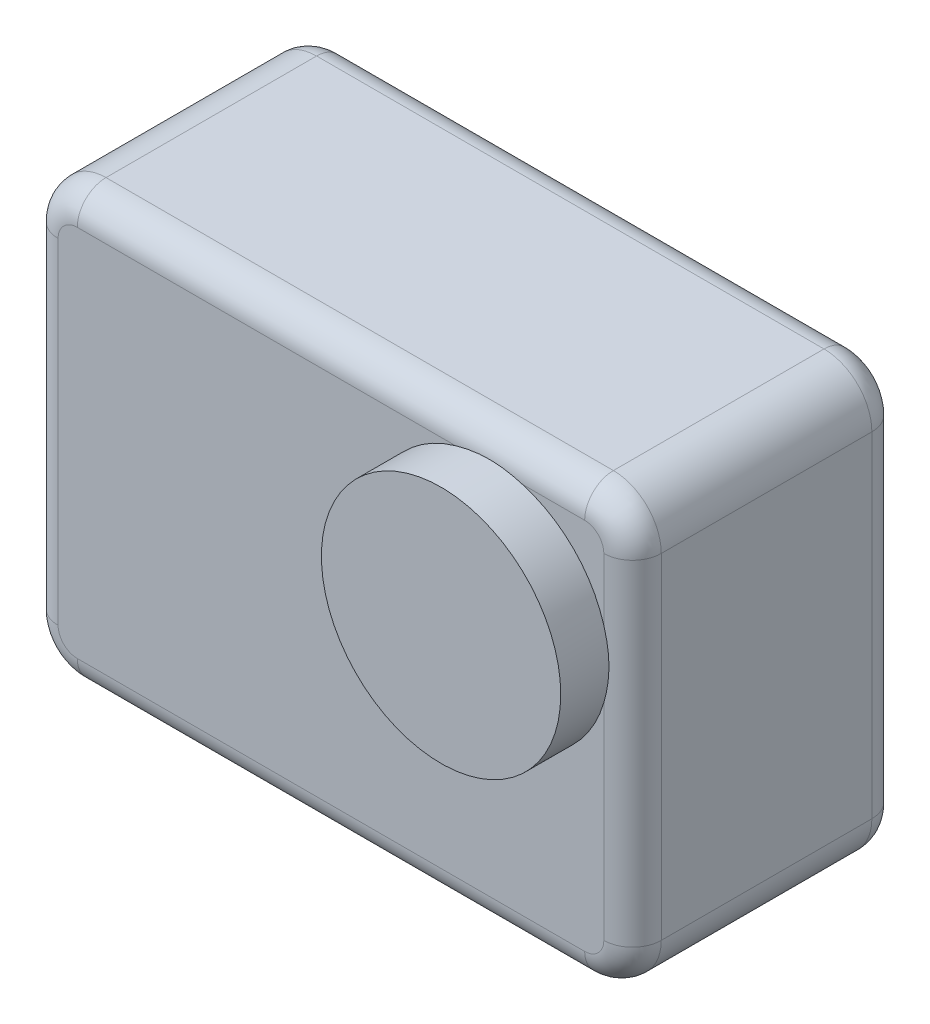
from build123d import *

# Parameters (mm, degrees)
BOSS_EXTRUDE1_DEPTH = 28
FILLET1_R           = 3
SKETCH4_R           = 12.5
BOSS_EXTRUDE3_DEPTH = 5


with BuildPart() as part:
    # Sketch3 → Boss-Extrude1 (new body)
    with BuildSketch(Plane.XY):
        with BuildLine():
            Line((5, 0), (58, 0))
            ThreePointArc((58, 0), (61.535533906, 1.464466094), (63, 5))
            Line((63, 5), (63, 40))
            ThreePointArc((63, 40), (61.535533906, 43.535533906), (58, 45))
            Line((58, 45), (5, 45))
            ThreePointArc((5, 45), (1.464466094, 43.535533906), (0, 40))
            Line((0, 40), (0, 5))
            ThreePointArc((0, 5), (1.464466094, 1.464466094), (5, 0))
        make_face()
    extrude(amount=BOSS_EXTRUDE1_DEPTH)

    # Fillet1
    fillet1_edges = [part.edges().sort_by_distance(p)[0] for p in [
        (31.5, 0, 0),
        (61.535533906, 1.464466094, 0),
        (63, 22.5, 0),
        (61.535533906, 43.535533906, 0),
        (31.5, 45, 0),
        (1.464466094, 43.535533906, 0),
        (0, 22.5, 0),
        (1.464466094, 1.464466094, 0),
        (0, 22.5, 28),
        (1.464466094, 43.535533906, 28),
        (31.5, 45, 28),
        (61.535533906, 43.535533906, 28),
        (63, 22.5, 28),
        (61.535533906, 1.464466094, 28),
        (31.5, 0, 28),
        (1.464466094, 1.464466094, 28),
    ]]
    fillet(fillet1_edges, radius=FILLET1_R)

    # Sketch4 → Boss-Extrude3 (add, symmetric)
    with BuildSketch(Plane.XY.offset(28)):
        with Locations((48, 30)):
            Circle(SKETCH4_R)
    extrude(amount=BOSS_EXTRUDE3_DEPTH, both=True)


solid = part.part
